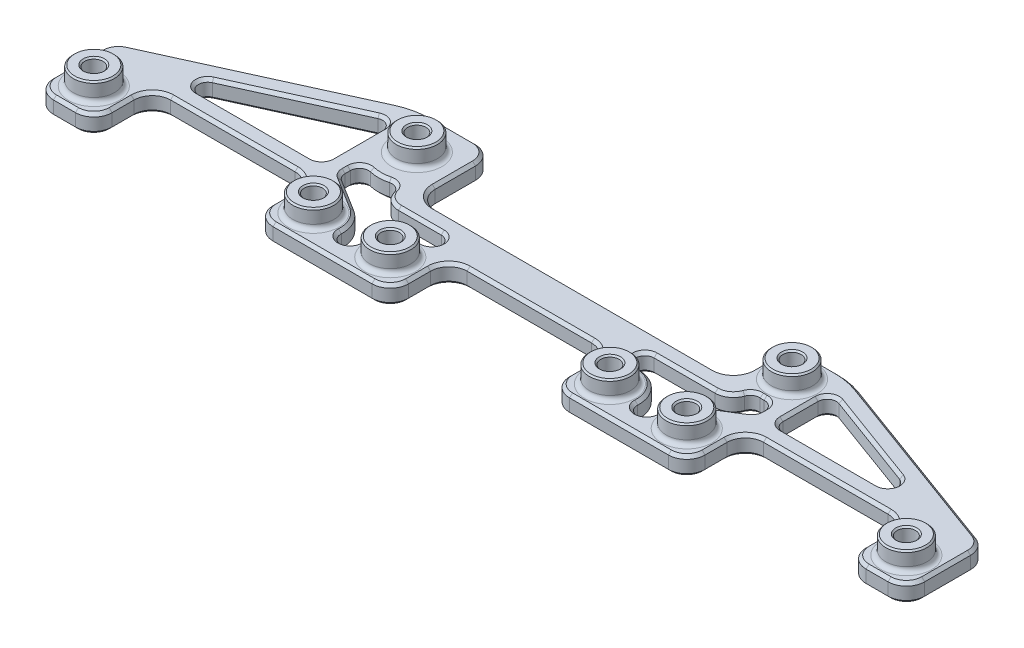
from build123d import *

# Parameters (mm, degrees)
BOSS_EXTRUDE2_DEPTH = 3.175
SKETCH4_R           = 3.571875
BOSS_EXTRUDE3_DEPTH = 3.175
CUT_EXTRUDE1_REACH  = 79.611
SKETCH3_R           = 1.5875
FILLET3_R           = 12.7
FILLET1_R           = 3.175
FILLET2_R           = 1.5875
FILLET5_R           = 0.79375
CHAMFER1_SIZE       = 0.508
CHAMFER2_SIZE       = 0.254


with BuildPart() as part:
    # Sketch2 → Boss-Extrude2 (new body)
    with BuildSketch(Plane(origin=(0, 0, 0), x_dir=(1, 0, 0), z_dir=(0, 1, 0))):
        Polygon((-25.8699, 16.5227), (-39.2176, 16.5227), (-75.565, 0), (-75.565, -13.335), (-65.405, -13.335), (-65.405, -3.175), (-37.465, -3.175), (-37.465, -13.335), (-13.97, -13.335), (-13.97, -3.175), (13.97, -3.175), (13.97, -13.335), (37.465, -13.335), (37.465, -3.175), (65.405, -3.175), (65.405, -13.335), (75.565, -13.335), (75.565, 0), (39.2176, 13.3477), (29.0449, 13.3477), (29.0449, 3.175), (-25.8699, 3.175), align=None)
        Polygon((-39.2176, 13.035051815), (-39.2176, 0), (-67.892710141, 0), align=None, mode=Mode.SUBTRACT)
        Polygon((39.2176, 9.965386453), (39.2176, 0), (66.354551502, 0), align=None, mode=Mode.SUBTRACT)
        with BuildLine():
            Line((23.759286039, -10.16), (27.675713961, -10.16))
            ThreePointArc((27.675713961, -10.16), (27.555150849, -6.680529556), (29.70316488, -3.940586901))
            Line((29.70316488, -3.940586901), (36.0426, 0))
            Line((36.0426, 0), (36.0426, 3.547784736))
            ThreePointArc((36.0426, 3.547784736), (34.118779591, 3.175015287), (32.196810172, 3.557213642))
            ThreePointArc((32.196810172, 3.557213642), (31.421257855, 1.069400716), (29.0449, 0))
            Line((29.0449, 0), (13.97, 0))
            ThreePointArc((13.97, 0), (16.345622019, -1.068570551), (17.122176491, -3.555011009))
            ThreePointArc((17.122176491, -3.555011009), (22.633378761, -4.654194999), (23.759286039, -10.16))
        make_face(mode=Mode.SUBTRACT)
        with BuildLine():
            Line((-36.0426, 4.165688688), (-36.0426, 0))
            Line((-36.0426, 0), (-29.70316488, -3.940586901))
            ThreePointArc((-29.70316488, -3.940586901), (-27.555150849, -6.680529556), (-27.675713961, -10.16))
            Line((-27.675713961, -10.16), (-23.759286039, -10.16))
            ThreePointArc((-23.759286039, -10.16), (-22.633378761, -4.654194999), (-17.122176491, -3.555011009))
            ThreePointArc((-17.122176491, -3.555011009), (-16.345622019, -1.068570551), (-13.97, 0))
            Line((-13.97, 0), (-25.8699, 0))
            ThreePointArc((-25.8699, 0), (-28.481705827, 1.369703536), (-28.840031542, 4.297026569))
            ThreePointArc((-28.840031542, 4.297026569), (-32.422073457, 3.176109286), (-36.0426, 4.165688688))
        make_face(mode=Mode.SUBTRACT)
    extrude(amount=BOSS_EXTRUDE2_DEPTH)

    # Sketch4 → Boss-Extrude3 (add)
    with BuildSketch(Plane(origin=(0, 3.175, 0), x_dir=(1, 0, 0), z_dir=(0, 1, 0))):
        with Locations((-32.385, -8.255)):
            Circle(SKETCH4_R)
        with Locations((-19.05, -8.255)):
            Circle(SKETCH4_R)
        with Locations((19.05, -8.255)):
            Circle(SKETCH4_R)
        with Locations((70.485, -8.255)):
            Circle(SKETCH4_R)
        with Locations((-70.485, -8.255)):
            Circle(SKETCH4_R)
        with Locations((32.385, -8.255)):
            Circle(SKETCH4_R)
        with Locations((-32.54375, 9.84885)):
            Circle(SKETCH4_R)
        with Locations((34.13125, 8.26135)):
            Circle(SKETCH4_R)
    extrude(amount=BOSS_EXTRUDE3_DEPTH)

    # Sketch3 → Cut-Extrude1 (cut, up to next)
    with BuildSketch(Plane(origin=(0, 0, 0), x_dir=(1, 0, 0), z_dir=(0, 1, 0)), mode=Mode.PRIVATE) as cut_extrude1_sk1:
        with Locations((-70.485, -8.255)):
            Circle(SKETCH3_R)
    cut_extrude1_tool1 = extrude(cut_extrude1_sk1.sketch, amount=CUT_EXTRUDE1_REACH, mode=Mode.PRIVATE) & part.part
    # Sketch3 → Cut-Extrude1 (cut, up to next)
    with BuildSketch(Plane(origin=(0, 0, 0), x_dir=(1, 0, 0), z_dir=(0, 1, 0)), mode=Mode.PRIVATE) as cut_extrude1_sk2:
        with Locations((-32.54375, 9.84885)):
            Circle(SKETCH3_R)
    cut_extrude1_tool2 = extrude(cut_extrude1_sk2.sketch, amount=CUT_EXTRUDE1_REACH, mode=Mode.PRIVATE) & part.part
    # Sketch3 → Cut-Extrude1 (cut, up to next)
    with BuildSketch(Plane(origin=(0, 0, 0), x_dir=(1, 0, 0), z_dir=(0, 1, 0)), mode=Mode.PRIVATE) as cut_extrude1_sk3:
        with Locations((34.13125, 8.26135)):
            Circle(SKETCH3_R)
    cut_extrude1_tool3 = extrude(cut_extrude1_sk3.sketch, amount=CUT_EXTRUDE1_REACH, mode=Mode.PRIVATE) & part.part
    # Sketch3 → Cut-Extrude1 (cut, up to next)
    with BuildSketch(Plane(origin=(0, 0, 0), x_dir=(1, 0, 0), z_dir=(0, 1, 0)), mode=Mode.PRIVATE) as cut_extrude1_sk4:
        with Locations((70.485, -8.255)):
            Circle(SKETCH3_R)
    cut_extrude1_tool4 = extrude(cut_extrude1_sk4.sketch, amount=CUT_EXTRUDE1_REACH, mode=Mode.PRIVATE) & part.part
    # Sketch3 → Cut-Extrude1 (cut, up to next)
    with BuildSketch(Plane(origin=(0, 0, 0), x_dir=(1, 0, 0), z_dir=(0, 1, 0)), mode=Mode.PRIVATE) as cut_extrude1_sk5:
        with Locations((32.385, -8.255)):
            Circle(SKETCH3_R)
    cut_extrude1_tool5 = extrude(cut_extrude1_sk5.sketch, amount=CUT_EXTRUDE1_REACH, mode=Mode.PRIVATE) & part.part
    # Sketch3 → Cut-Extrude1 (cut, up to next)
    with BuildSketch(Plane(origin=(0, 0, 0), x_dir=(1, 0, 0), z_dir=(0, 1, 0)), mode=Mode.PRIVATE) as cut_extrude1_sk6:
        with Locations((19.05, -8.255)):
            Circle(SKETCH3_R)
    cut_extrude1_tool6 = extrude(cut_extrude1_sk6.sketch, amount=CUT_EXTRUDE1_REACH, mode=Mode.PRIVATE) & part.part
    # Sketch3 → Cut-Extrude1 (cut, up to next)
    with BuildSketch(Plane(origin=(0, 0, 0), x_dir=(1, 0, 0), z_dir=(0, 1, 0)), mode=Mode.PRIVATE) as cut_extrude1_sk7:
        with Locations((-19.05, -8.255)):
            Circle(SKETCH3_R)
    cut_extrude1_tool7 = extrude(cut_extrude1_sk7.sketch, amount=CUT_EXTRUDE1_REACH, mode=Mode.PRIVATE) & part.part
    # Sketch3 → Cut-Extrude1 (cut, up to next)
    with BuildSketch(Plane(origin=(0, 0, 0), x_dir=(1, 0, 0), z_dir=(0, 1, 0)), mode=Mode.PRIVATE) as cut_extrude1_sk8:
        with Locations((-32.385, -8.255)):
            Circle(SKETCH3_R)
    cut_extrude1_tool8 = extrude(cut_extrude1_sk8.sketch, amount=CUT_EXTRUDE1_REACH, mode=Mode.PRIVATE) & part.part
    add(cut_extrude1_tool1.solids().sort_by_distance((-70.485, 0, 8.255))[0], mode=Mode.SUBTRACT)
    add(cut_extrude1_tool2.solids().sort_by_distance((-32.54375, 0, -9.84885))[0], mode=Mode.SUBTRACT)
    add(cut_extrude1_tool3.solids().sort_by_distance((34.13125, 0, -8.26135))[0], mode=Mode.SUBTRACT)
    add(cut_extrude1_tool4.solids().sort_by_distance((70.485, 0, 8.255))[0], mode=Mode.SUBTRACT)
    add(cut_extrude1_tool5.solids().sort_by_distance((32.385, 0, 8.255))[0], mode=Mode.SUBTRACT)
    add(cut_extrude1_tool6.solids().sort_by_distance((19.05, 0, 8.255))[0], mode=Mode.SUBTRACT)
    add(cut_extrude1_tool7.solids().sort_by_distance((-19.05, 0, 8.255))[0], mode=Mode.SUBTRACT)
    add(cut_extrude1_tool8.solids().sort_by_distance((-32.385, 0, 8.255))[0], mode=Mode.SUBTRACT)

    # Fillet3
    fillet3_edges = [part.edges().sort_by_distance(p)[0] for p in [
        (-39.2176, 1.5875, -16.5227),
        (39.2176, 1.5875, -13.3477),
    ]]
    fillet(fillet3_edges, radius=FILLET3_R)

    # Fillet1
    fillet1_edges = [part.edges().sort_by_distance(p)[0] for p in [
        (-75.565, 1.5875, 13.335),
        (-75.565, 1.5875, 0),
        (-25.8699, 1.5875, -16.5227),
        (-25.8699, 1.5875, -3.175),
        (29.0449, 1.5875, -3.175),
        (29.0449, 1.5875, -13.3477),
        (75.565, 1.5875, 0),
        (75.565, 1.5875, 13.335),
        (65.405, 1.5875, 13.335),
        (65.405, 1.5875, 3.175),
        (37.465, 1.5875, 3.175),
        (37.465, 1.5875, 13.335),
        (13.97, 1.5875, 13.335),
        (13.97, 1.5875, 3.175),
        (-13.97, 1.5875, 3.175),
        (-13.97, 1.5875, 13.335),
        (-37.465, 1.5875, 13.335),
        (-37.465, 1.5875, 3.175),
        (-65.405, 1.5875, 3.175),
        (-65.405, 1.5875, 13.335),
    ]]
    fillet(fillet1_edges, radius=FILLET1_R)

    # Fillet2
    fillet2_edges = [part.edges().sort_by_distance(p)[0] for p in [
        (39.2176, 1.5875, 0),
        (66.354551502, 1.5875, 0),
        (39.2176, 1.5875, -9.965386453),
        (-67.892710141, 1.5875, 0),
        (-39.2176, 1.5875, 0),
        (-39.2176, 1.5875, -13.035051815),
        (-27.675713961, 1.5875, 10.16),
        (-36.0426, 1.5875, 0),
        (-28.840031542, 1.5875, -4.297026569),
        (-36.0426, 1.5875, -4.165688688),
        (-23.759286039, 1.5875, 10.16),
        (-17.122176491, 1.5875, 3.555011009),
        (23.759286039, 1.5875, 10.16),
        (27.675713961, 1.5875, 10.16),
        (36.0426, 1.5875, 0),
        (36.0426, 1.5875, -3.547784736),
        (17.122176491, 1.5875, 3.555011009),
        (32.196810172, 1.5875, -3.557213642),
    ]]
    fillet(fillet2_edges, radius=FILLET2_R)
    fillet2_2_edges = [part.edges().sort_by_distance(p)[0] for p in [
        (-13.97, 1.5875, 0),
        (13.97, 1.5875, 0),
    ]]
    fillet(fillet2_2_edges, radius=FILLET2_R)

    # Fillet5
    fillet5_edges = [part.edges().sort_by_distance(p)[0] for p in [
        (66.913125, 3.175, 8.255),
        (15.478125, 3.175, 8.255),
        (-22.621875, 3.175, 8.255),
        (-35.956875, 3.175, 8.255),
        (-74.056875, 3.175, 8.255),
        (28.813125, 3.175, 8.255),
        (30.559375, 3.175, -8.26135),
        (-36.115625, 3.175, -9.84885),
    ]]
    fillet(fillet5_edges, radius=FILLET5_R)

    # Chamfer1
    chamfer1_edges = [part.edges().sort_by_distance(p)[0] for p in [
        (30.885442501, 0, -0.58791123),
        (32.68167253, 0, -2.946189972),
        (34.030678461, 0, -3.175994389),
        (35.550057791, 0, -2.744807023),
        (36.0426, 0, -1.238886674),
        (35.842651421, 0, -0.111141342),
        (32.498169178, 0, 2.203214862),
        (27.8873148, 0, 5.893384485),
        (26.874011961, 0, 9.667979075),
        (25.7175, 0, 10.16),
        (24.560988039, 0, 9.667979075),
        (22.57025999, 0, 4.592464047),
        (17.606106489, 0, 2.945357344),
        (16.96639264, 0, 2.125116127),
        (17.163939738, 0, 0.670956448),
        (23.75251403, 0, 0),
        (-29.662056854, 0, -3.238116443),
        (-27.779501718, 0, -0.638457811),
        (-22.16501403, 0, 0),
        (-17.163939738, 0, 0.670956448),
        (-16.96639264, 0, 2.125116127),
        (-17.606106489, 0, 2.945357344),
        (-22.57025999, 0, 4.592464047),
        (-24.560988039, 0, 9.667979075),
        (-25.7175, 0, 10.16),
        (-26.874011961, 0, 9.667979075),
        (-27.8873148, 0, 5.893384485),
        (-32.498169178, 0, 2.203214862),
        (-35.842651421, 0, -0.111141342),
        (-36.0426, 0, -1.347028733),
        (-35.43924726, 0, -3.057282747),
        (-32.46643407, 0, -3.175447864),
        (39.896415498, 0, -8.992968779),
        (49.662975014, 0, -6.129576132),
        (58.989357812, 0, -1.309589059),
        (49.115736462, 0, 0),
        (39.682567985, 0, -0.464967985),
        (39.2176, 0, -4.639379428),
        (-62.115823767, 0, -1.251406311),
        (-51.341654846, 0, -7.523732683),
        (-39.945667694, 0, -11.904326947),
        (-39.2176, 0, -6.078543194),
        (-39.682567985, 0, -0.464967985),
        (-50.684704628, 0, 0),
        (-66.33493597, 0, 12.40506403),
        (-65.405, 0, 8.255),
        (-64.47506403, 0, 4.10493597),
        (-51.435, 0, 3.175),
        (-38.39493597, 0, 4.10493597),
        (-37.465, 0, 8.255),
        (-36.53506403, 0, 12.40506403),
        (-25.7175, 0, 13.335),
        (-14.89993597, 0, 12.40506403),
        (-13.97, 0, 8.255),
        (-13.04006403, 0, 4.10493597),
        (0, 0, 3.175),
        (13.04006403, 0, 4.10493597),
        (13.97, 0, 8.255),
        (14.89993597, 0, 12.40506403),
        (25.7175, 0, 13.335),
        (36.53506403, 0, 12.40506403),
        (37.465, 0, 8.255),
        (38.39493597, 0, 4.10493597),
        (51.435, 0, 3.175),
        (64.47506403, 0, 4.10493597),
        (65.405, 0, 8.255),
        (66.33493597, 0, 12.40506403),
        (70.485, 0, 13.335),
        (74.63506403, 0, 12.40506403),
        (75.565, 0, 6.188185949),
        (74.993419848, 0, 0.399002894),
        (57.410913082, 0, -6.666647572),
        (39.18272817, 0, -13.151579101),
        (34.589670321, 0, -13.3477),
        (29.97483597, 0, -12.41776403),
        (29.0449, 0, -8.26135),
        (28.11496403, 0, -4.10493597),
        (1.5875, 0, -3.175),
        (-24.93996403, 0, -4.10493597),
        (-25.8699, 0, -9.84885),
        (-26.79983597, 0, -15.59276403),
        (-32.75569411, 0, -16.5227),
        (-39.155237733, 0, -16.234816099),
        (-57.712995204, 0, -8.115114689),
        (-75.059481119, 0, 0.325500903),
        (-75.565, 0, 6.102182758),
        (-74.63506403, 0, 12.40506403),
        (-70.485, 0, 13.335),
        (24.560988039, 3.175, 9.667979075),
        (25.7175, 3.175, 10.16),
        (26.874011961, 3.175, 9.667979075),
        (27.8873148, 3.175, 5.893384485),
        (32.498169178, 3.175, 2.203214862),
        (35.842651421, 3.175, -0.111141342),
        (36.0426, 3.175, -1.238886674),
        (35.550057791, 3.175, -2.744807023),
        (34.030678461, 3.175, -3.175994389),
        (32.68167253, 3.175, -2.946189972),
        (30.885442501, 3.175, -0.58791123),
        (23.75251403, 3.175, 0),
        (17.163939738, 3.175, 0.670956448),
        (16.96639264, 3.175, 2.125116127),
        (17.606106489, 3.175, 2.945357344),
        (22.57025999, 3.175, 4.592464047),
        (39.896415498, 3.175, -8.992968779),
        (39.2176, 3.175, -4.639379428),
        (39.682567985, 3.175, -0.464967985),
        (49.115736462, 3.175, 0),
        (58.989357812, 3.175, -1.309589059),
        (49.662975014, 3.175, -6.129576132),
        (-75.059481119, 3.175, 0.325500903),
        (-57.712995204, 3.175, -8.115114689),
        (-39.155237733, 3.175, -16.234816099),
        (-32.75569411, 3.175, -16.5227),
        (-26.79983597, 3.175, -15.59276403),
        (-25.8699, 3.175, -9.84885),
        (-24.93996403, 3.175, -4.10493597),
        (1.5875, 3.175, -3.175),
        (28.11496403, 3.175, -4.10493597),
        (29.0449, 3.175, -8.26135),
        (29.97483597, 3.175, -12.41776403),
        (34.589670321, 3.175, -13.3477),
        (39.18272817, 3.175, -13.151579101),
        (57.410913082, 3.175, -6.666647572),
        (74.993419848, 3.175, 0.399002894),
        (75.565, 3.175, 6.188185949),
        (74.63506403, 3.175, 12.40506403),
        (70.485, 3.175, 13.335),
        (66.33493597, 3.175, 12.40506403),
        (65.405, 3.175, 8.255),
        (64.47506403, 3.175, 4.10493597),
        (51.435, 3.175, 3.175),
        (38.39493597, 3.175, 4.10493597),
        (37.465, 3.175, 8.255),
        (36.53506403, 3.175, 12.40506403),
        (25.7175, 3.175, 13.335),
        (14.89993597, 3.175, 12.40506403),
        (13.97, 3.175, 8.255),
        (13.04006403, 3.175, 4.10493597),
        (0, 3.175, 3.175),
        (-13.04006403, 3.175, 4.10493597),
        (-13.97, 3.175, 8.255),
        (-14.89993597, 3.175, 12.40506403),
        (-25.7175, 3.175, 13.335),
        (-36.53506403, 3.175, 12.40506403),
        (-37.465, 3.175, 8.255),
        (-38.39493597, 3.175, 4.10493597),
        (-51.435, 3.175, 3.175),
        (-64.47506403, 3.175, 4.10493597),
        (-66.33493597, 3.175, 12.40506403),
        (-74.63506403, 3.175, 12.40506403),
        (-62.115823767, 3.175, -1.251406311),
        (-50.684704628, 3.175, 0),
        (-39.682567985, 3.175, -0.464967985),
        (-39.2176, 3.175, -6.078543194),
        (-39.945667694, 3.175, -11.904326947),
        (-51.341654846, 3.175, -7.523732683),
        (-27.8873148, 3.175, 5.893384485),
        (-26.874011961, 3.175, 9.667979075),
        (-25.7175, 3.175, 10.16),
        (-24.560988039, 3.175, 9.667979075),
        (-22.57025999, 3.175, 4.592464047),
        (-17.606106489, 3.175, 2.945357344),
        (-16.96639264, 3.175, 2.125116127),
        (-17.163939738, 3.175, 0.670956448),
        (-22.16501403, 3.175, 0),
        (-27.779501718, 3.175, -0.638457811),
        (-29.662056854, 3.175, -3.238116443),
        (-32.46643407, 3.175, -3.175447864),
        (-35.43924726, 3.175, -3.057282747),
        (-36.0426, 3.175, -1.347028733),
        (-35.842651421, 3.175, -0.111141342),
        (-32.498169178, 3.175, 2.203214862),
        (-65.405, 3.175, 8.255),
        (-70.485, 3.175, 13.335),
        (-75.565, 3.175, 6.102182758),
    ]]
    chamfer(chamfer1_edges, length=CHAMFER1_SIZE)

    # Chamfer2
    chamfer2_edges = [part.edges().sort_by_distance(p)[0] for p in [
        (68.8975, 0, 8.255),
        (68.8975, 6.35, 8.255),
        (30.7975, 0, 8.255),
        (30.7975, 6.35, 8.255),
        (17.4625, 0, 8.255),
        (17.4625, 6.35, 8.255),
        (32.54375, 0, -8.26135),
        (-20.6375, 0, 8.255),
        (-20.6375, 6.35, 8.255),
        (-34.13125, 0, -9.84885),
        (-33.9725, 0, 8.255),
        (-33.9725, 6.35, 8.255),
        (-72.0725, 0, 8.255),
        (-72.0725, 6.35, 8.255),
        (66.913125, 6.35, 8.255),
        (28.813125, 6.35, 8.255),
        (15.478125, 6.35, 8.255),
        (-22.621875, 6.35, 8.255),
        (-35.956875, 6.35, 8.255),
        (-74.056875, 6.35, 8.255),
        (32.54375, 6.35, -8.26135),
        (-34.13125, 6.35, -9.84885),
        (30.559375, 6.35, -8.26135),
        (-36.115625, 6.35, -9.84885),
    ]]
    chamfer(chamfer2_edges, length=CHAMFER2_SIZE)


solid = part.part
